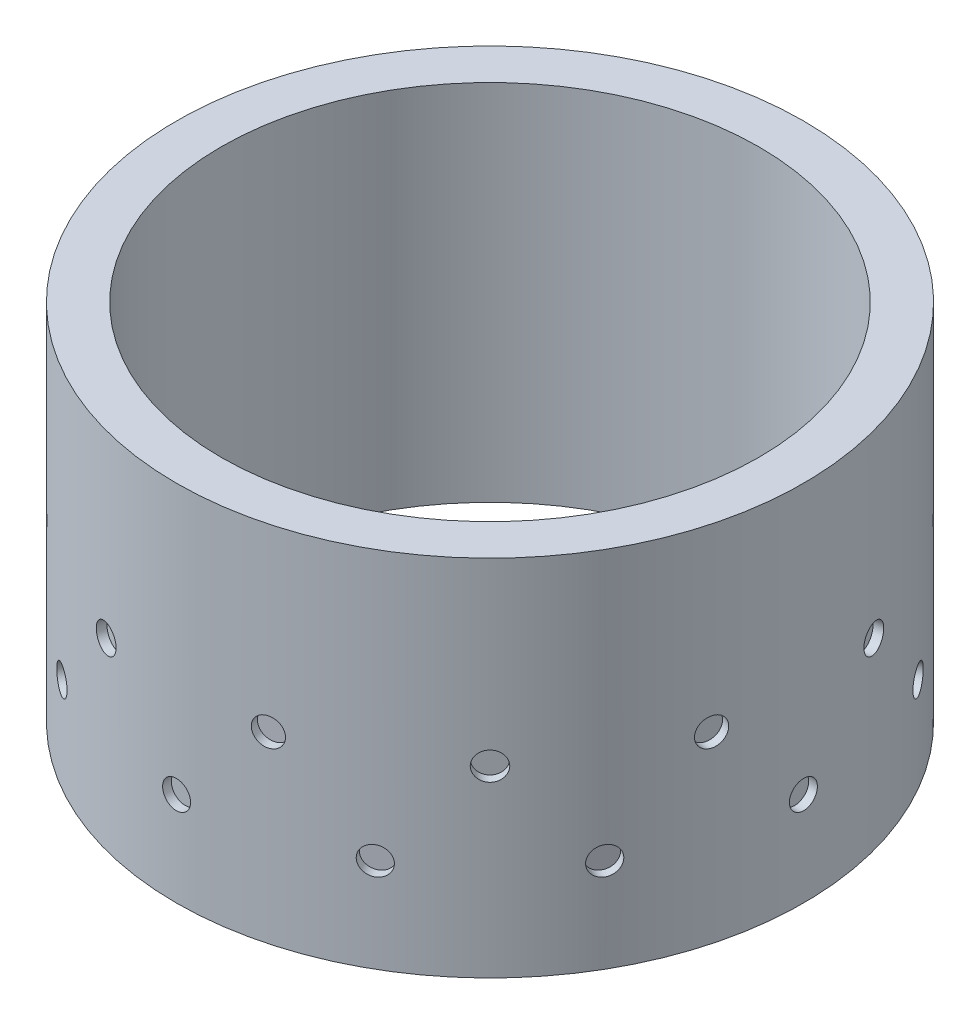
from build123d import *

# Parameters (mm, degrees)
SKETCH1_R           = 89.027
SKETCH1_R_2         = 76.327
BOSS_EXTRUDE1_DEPTH = 103.1875
SKETCH3_R           = 3.96875
CUT_EXTRUDE1_DEPTH  = 2.54
CIRPATTERN1_COUNT   = 12
SKETCH4_R           = 3.96875
CUT_EXTRUDE2_DEPTH  = 2.54
CIRPATTERN2_COUNT   = 12


with BuildPart() as part:
    # Sketch1 → Boss-Extrude1 (new body)
    with BuildSketch(Plane(origin=(0, 0, 0), x_dir=(1, 0, 0), z_dir=(0, 1, 0))):
        Circle(SKETCH1_R)
        Circle(SKETCH1_R_2, mode=Mode.SUBTRACT)
    extrude(amount=BOSS_EXTRUDE1_DEPTH)

    # Sketch3 → Cut-Extrude1 (cut)
    with BuildSketch(Plane(origin=(0, 0, -89.027), x_dir=(-1, 0, 0), z_dir=(0, 0, -1))):
        with Locations((0, 26.67)):
            Circle(SKETCH3_R)
    cut_extrude1 = extrude(amount=-CUT_EXTRUDE1_DEPTH, mode=Mode.SUBTRACT)

    # CirPattern1: Cut-Extrude1 ×12 about axis
    cirpattern1_axis = Axis((0, 103.1875, 0), (0, -1, 0))
    for i in range(1, CIRPATTERN1_COUNT):
        add(cut_extrude1.rotate(cirpattern1_axis, i * 360 / CIRPATTERN1_COUNT), mode=Mode.SUBTRACT)

    # Sketch4 → Cut-Extrude2 (cut)
    with BuildSketch(Plane(origin=(-23.041883128, 0, 85.993478537), x_dir=(0, -1, 0), z_dir=(-0.25881904510252135, 0, 0.9659258262890681))):
        with Locations((-52.07, 0)):
            Circle(SKETCH4_R)
    cut_extrude2 = extrude(amount=-CUT_EXTRUDE2_DEPTH, mode=Mode.SUBTRACT)

    # CirPattern2: Cut-Extrude2 ×12 about axis
    cirpattern2_axis = Axis((0, 103.1875, 0), (0, -1, 0))
    for i in range(1, CIRPATTERN2_COUNT):
        add(cut_extrude2.rotate(cirpattern2_axis, i * 360 / CIRPATTERN2_COUNT), mode=Mode.SUBTRACT)


solid = part.part
